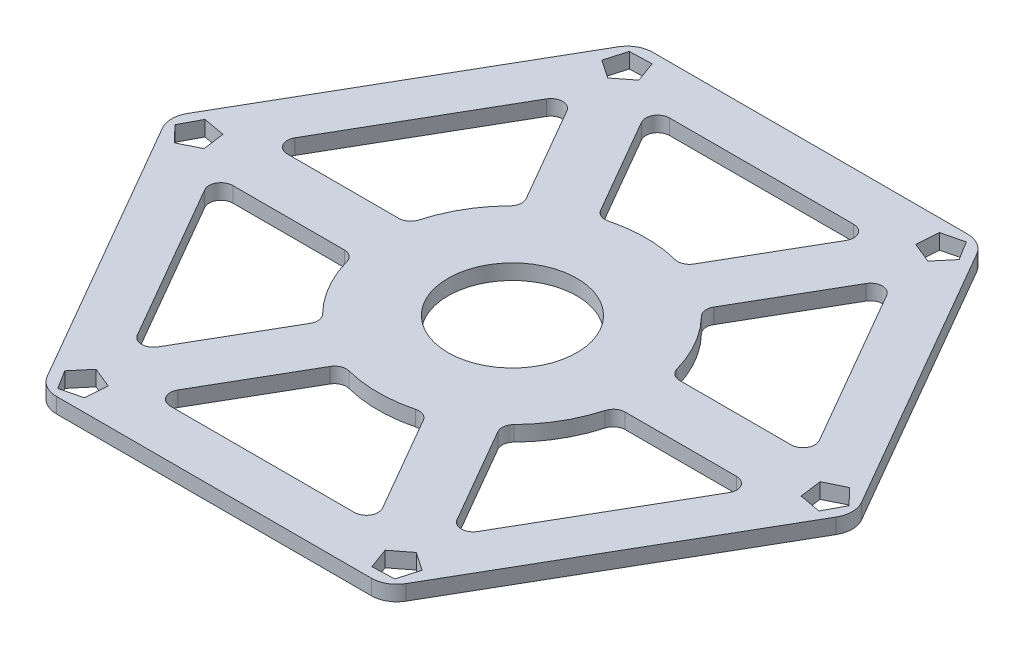
from build123d import *

# Parameters (mm, degrees)
SKETCH1_R           = 7.6
BOSS_EXTRUDE1_DEPTH = 1.8
FILLET1_R           = 3
FILLET2_R           = 1.4
SCALE1_SCALE        = 1.15


with BuildPart() as part:
    # Sketch1 → Boss-Extrude1 (new body)
    with BuildSketch(Plane(origin=(0, 0, 0), x_dir=(1, 0, 0), z_dir=(0, 1, 0))):
        Polygon((20.3, 35.160631394), (-20.3, 35.160631394), (-40.6, 0), (-20.3, -35.160631394), (20.3, -35.160631394), (40.6, 0), align=None)
        Polygon((-16.584596387, -31.040676977), (-16.771232891, -33.649562724), (-19.310104532, -34.278250893), (-20.692576995, -32.057915803), (-19.008120326, -30.056985082), align=None, mode=Mode.SUBTRACT)
        Polygon((-35.174313007, -1.157656706), (-37.526992591, -2.300467626), (-39.340888337, -0.416084372), (-38.109257976, 1.891339446), (-35.534172805, 1.433022539), align=None, mode=Mode.SUBTRACT)
        Polygon((18.589716619, -29.883020272), (20.7557597, -31.349095098), (20.030783805, -33.862166521), (17.41668098, -33.94925525), (16.52605248, -31.490007621), align=None, mode=Mode.SUBTRACT)
        with BuildLine():
            Line((-32.142053523, 3.218057696), (-18.857946477, 26.226806032))
            Line((-18.857946477, 26.226806032), (-10.521325069, 11.78735419))
            ThreePointArc((-10.521325069, 11.78735419), (-13.68320138, 7.9), (-15.468810706, 3.218057696))
            Line((-15.468810706, 3.218057696), (-32.142053523, 3.218057696))
        make_face(mode=Mode.SUBTRACT)
        with BuildLine():
            Line((-18.857946477, -26.226806032), (-32.142053523, -3.218057696))
            Line((-32.142053523, -3.218057696), (-15.468810706, -3.218057696))
            ThreePointArc((-15.468810706, -3.218057696), (-13.68320138, -7.9), (-10.521325069, -11.78735419))
            Line((-10.521325069, -11.78735419), (-18.857946477, -26.226806032))
        make_face(mode=Mode.SUBTRACT)
        with BuildLine():
            Line((13.284107046, -29.444863729), (-13.284107046, -29.444863729))
            Line((-13.284107046, -29.444863729), (-4.947485637, -15.005411886))
            ThreePointArc((-4.947485637, -15.005411886), (0, -15.8), (4.947485637, -15.005411886))
            Line((4.947485637, -15.005411886), (13.284107046, -29.444863729))
        make_face(mode=Mode.SUBTRACT)
        with BuildLine():
            Line((32.142053523, -3.218057696), (18.857946477, -26.226806032))
            Line((18.857946477, -26.226806032), (10.521325069, -11.78735419))
            ThreePointArc((10.521325069, -11.78735419), (13.68320138, -7.9), (15.468810706, -3.218057696))
            Line((15.468810706, -3.218057696), (32.142053523, -3.218057696))
        make_face(mode=Mode.SUBTRACT)
        with BuildLine():
            Line((18.857946477, 26.226806032), (32.142053523, 3.218057696))
            Line((32.142053523, 3.218057696), (15.468810706, 3.218057696))
            ThreePointArc((15.468810706, 3.218057696), (13.68320138, 7.9), (10.521325069, 11.78735419))
            Line((10.521325069, 11.78735419), (18.857946477, 26.226806032))
        make_face(mode=Mode.SUBTRACT)
        with BuildLine():
            Line((-13.284107046, 29.444863729), (13.284107046, 29.444863729))
            Line((13.284107046, 29.444863729), (4.947485637, 15.005411886))
            ThreePointArc((4.947485637, 15.005411886), (0, 15.8), (-4.947485637, 15.005411886))
            Line((-4.947485637, 15.005411886), (-13.284107046, 29.444863729))
        make_face(mode=Mode.SUBTRACT)
        Polygon((-18.589716619, 29.883020272), (-20.7557597, 31.349095098), (-20.030783805, 33.862166521), (-17.41668098, 33.94925525), (-16.52605248, 31.490007621), align=None, mode=Mode.SUBTRACT)
        Polygon((35.174313007, 1.157656706), (37.526992591, 2.300467626), (39.340888337, 0.416084372), (38.109257976, -1.891339446), (35.534172805, -1.433022539), align=None, mode=Mode.SUBTRACT)
        Polygon((16.584596387, 31.040676977), (16.771232891, 33.649562724), (19.310104532, 34.278250893), (20.692576995, 32.057915803), (19.008120326, 30.056985082), align=None, mode=Mode.SUBTRACT)
        with Locations(Location((0.052857117, 0, 0), (0, 0, 270))):
            Circle(SKETCH1_R, mode=Mode.SUBTRACT)
    extrude(amount=BOSS_EXTRUDE1_DEPTH)

    # Fillet1
    # the kernel refuses this fillet: 3 mm, written as the material it takes off along each edge
    with BuildSketch(Plane(origin=(40.6, -4.330127019, 0), x_dir=(-0.4999999999998131, 0, -0.8660254037845465), z_dir=(0, 1, 0))) as fillet1_piece_1:
        with BuildLine():
            CenterArc((FILLET1_R * 0.577350269186, FILLET1_R), FILLET1_R, 210, 60)
            Line((-FILLET1_R * 0.288675134596, FILLET1_R * 0.499999999995), (0, 0))
            Line((0, 0), (FILLET1_R * 0.577350269186, 0))
        make_face()
    extrude(amount=10.460254038, mode=Mode.SUBTRACT)
    with BuildSketch(Plane(origin=(20.3, -4.330127019, 35.160631394), x_dir=(-1.0, 0, -2.4203690345734148e-12), z_dir=(0, 1, 0)), Plane(origin=(-20.3, -4.330127019, 35.160631394), x_dir=(-0.5000000000021431, 0, -0.8660254037832013), z_dir=(0, 1, 0)), Plane(origin=(-40.6, -4.330127019, 0), x_dir=(0.49999999999780936, 0, -0.8660254037857034), z_dir=(0, 1, 0)), Plane(origin=(-20.3, -4.330127019, -35.160631394), x_dir=(1, 0, 0), z_dir=(0, 1, 0)), Plane(origin=(20.3, -4.330127019, -35.160631394), x_dir=(0.49999999999981115, 0, 0.8660254037845477), z_dir=(0, 1, 0))) as fillet1_piece_2:
        with BuildLine():
            CenterArc((FILLET1_R * 0.577350269195, -FILLET1_R), FILLET1_R, 90, 60)
            Line((-FILLET1_R * 0.288675134594, -FILLET1_R * 0.500000000007), (0, 0))
            Line((0, 0), (FILLET1_R * 0.577350269195, 0))
        make_face()
    extrude(amount=10.460254038, mode=Mode.SUBTRACT)

    # Fillet2
    fillet2_edges = [part.edges().sort_by_distance(p)[0] for p in [
        (-32.142053523, 0.9, -3.218057696),
        (-15.468810706, 0.9, -3.218057696),
        (-10.521325069, 0.9, -11.78735419),
        (-18.857946477, 0.9, -26.226806032),
        (-18.857946477, 0.9, 26.226806032),
        (-10.521325069, 0.9, 11.78735419),
        (-15.468810706, 0.9, 3.218057696),
        (-32.142053523, 0.9, 3.218057696),
        (13.284107046, 0.9, 29.444863729),
        (4.947485637, 0.9, 15.005411886),
        (-4.947485637, 0.9, 15.005411886),
        (-13.284107046, 0.9, 29.444863729),
        (32.142053523, 0.9, 3.218057696),
        (15.468810706, 0.9, 3.218057696),
        (10.521325069, 0.9, 11.78735419),
        (18.857946477, 0.9, 26.226806032),
        (18.857946477, 0.9, -26.226806032),
        (10.521325069, 0.9, -11.78735419),
        (15.468810706, 0.9, -3.218057696),
        (32.142053523, 0.9, -3.218057696),
        (-13.284107046, 0.9, -29.444863729),
        (-4.947485637, 0.9, -15.005411886),
        (4.947485637, 0.9, -15.005411886),
        (13.284107046, 0.9, -29.444863729),
    ]]
    fillet(fillet2_edges, radius=FILLET2_R)


with BuildPart() as part_1:
    # Scale1: scaled about (-0.00383883, 0.9, 0)
    add(part.part.scale(SCALE1_SCALE).moved(Location((0.000575824, -0.135, 0))))


solid = part_1.part
